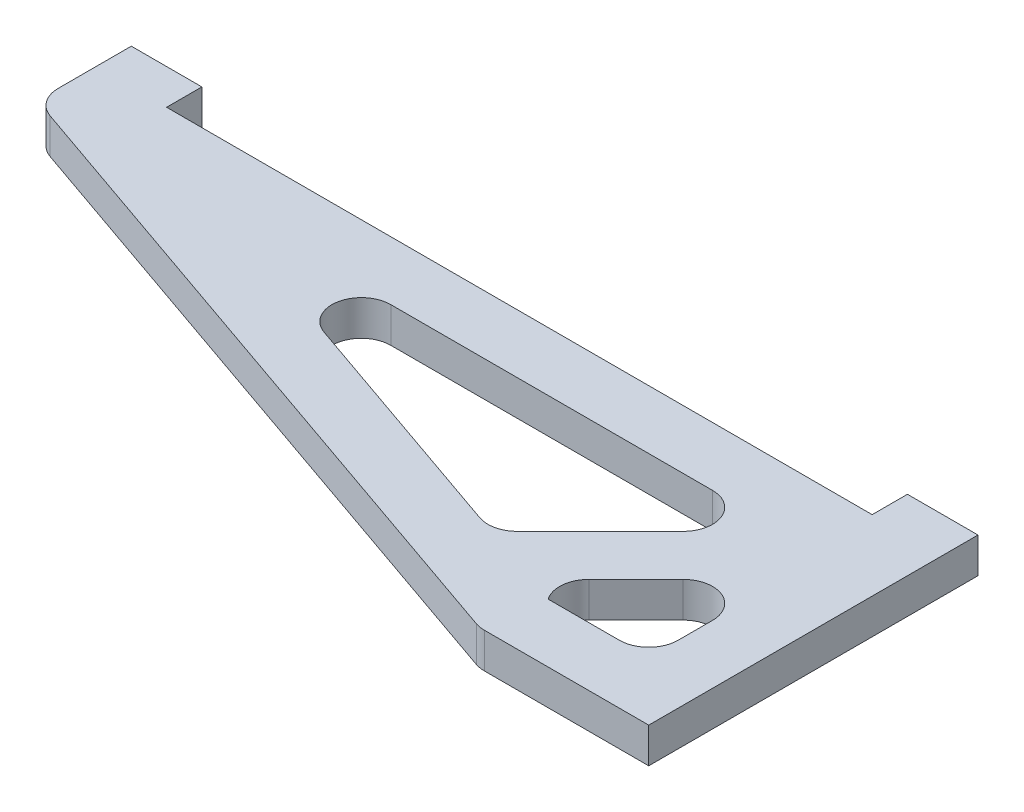
from build123d import *

# Parameters (mm, degrees)
SKETCH1_W           = 6
SKETCH1_H           = 3
BOSS_EXTRUDE1_DEPTH = 3
CUT_EXTRUDE1_REACH  = 41.31
FILLET1_R           = 2.5


with BuildPart() as part:
    # Sketch1 → Boss-Extrude1 (new body)
    with BuildSketch(Plane(origin=(0, 0, 0), x_dir=(1, 0, 0), z_dir=(0, 1, 0))):
        Polygon((-36, 12.5), (-36, 7.5), (21.6, -12.5), (36, -12.5), (36, 12.5), (30, 12.5), (-30, 12.5), align=None)
        with Locations((-33, 14)):
            Rectangle(SKETCH1_W, SKETCH1_H)
        with Locations((33, 14)):
            Rectangle(SKETCH1_W, SKETCH1_H)
    extrude(amount=BOSS_EXTRUDE1_DEPTH)

    # Sketch2 → Cut-Extrude1 (cut, up to next)
    with BuildSketch(Plane(origin=(0, 3, 0), x_dir=(1, 0, 0), z_dir=(0, 1, 0)), mode=Mode.PRIVATE) as cut_extrude1_sk1:
        Polygon((-20.75664079, 7.5), (15.036345763, -4.928120331), (27.464466094, 7.5), align=None)
    cut_extrude1_tool1 = extrude(cut_extrude1_sk1.sketch, amount=-CUT_EXTRUDE1_REACH, mode=Mode.PRIVATE) & part.part
    # Sketch2 → Cut-Extrude1 (cut, up to next)
    with BuildSketch(Plane(origin=(0, 3, 0), x_dir=(1, 0, 0), z_dir=(0, 1, 0)), mode=Mode.PRIVATE) as cut_extrude1_sk2:
        Polygon((31, 3.964466094), (20.284973417, -6.750560489), (22.44335921, -7.5), (31, -7.5), align=None)
    cut_extrude1_tool2 = extrude(cut_extrude1_sk2.sketch, amount=-CUT_EXTRUDE1_REACH, mode=Mode.PRIVATE) & part.part
    add(cut_extrude1_tool1.solids().sort_by_distance((7.248057, 3, -3.357293))[0], mode=Mode.SUBTRACT)
    add(cut_extrude1_tool2.solids().sort_by_distance((27.286818, 3, 3.618293))[0], mode=Mode.SUBTRACT)

    # Fillet1
    # the kernel refuses this fillet: 2.5 mm, written as the material it adds along each edge
    with BuildSketch(Plane(origin=(20.284973417, 3, 6.750560489), x_dir=(0.7071067811865467, 0, -0.7071067811865482), z_dir=(0, -1, 0))) as fillet1_piece_1:
        with BuildLine():
            CenterArc((3.456558168, 2.5), FILLET1_R, 190.226667661, 79.773332339)
            Line((0.99627547, 2.056142991), (0, 0))
            Line((0, 0), (3.456558168, 0))
        make_face()
    extrude(amount=3)
    with BuildSketch(Plane(origin=(31, 3, -3.964466094), x_dir=(0, 0, 1), z_dir=(0, -1, 0)), Plane(origin=(27.464466094, 3, -7.5), x_dir=(-0.7071067811865461, 0, 0.707106781186549), z_dir=(0, -1, 0))) as fillet1_piece_2:
        with BuildLine():
            CenterArc((FILLET1_R * 2.41421356237, FILLET1_R), FILLET1_R, 135, 135)
            Line((FILLET1_R * 1.70710678119, FILLET1_R * 1.70710678119), (0, 0))
            Line((0, 0), (FILLET1_R * 2.41421356237, 0))
        make_face()
    extrude(amount=3)
    with BuildSketch(Plane(origin=(31, 3, 7.5), x_dir=(0, 0, -1), z_dir=(0, -1, 0))) as fillet1_piece_3:
        with BuildLine():
            CenterArc((FILLET1_R, -FILLET1_R), FILLET1_R, 90, 90)
            Line((0, -FILLET1_R), (0, 0))
            Line((0, 0), (FILLET1_R, 0))
        make_face()
    extrude(amount=3)
    with BuildSketch(Plane(origin=(-20.75664079, 3, -7.5), x_dir=(0.9446736642347862, 0, 0.3280116889704124), z_dir=(0, -1, 0))) as fillet1_piece_4:
        with BuildLine():
            CenterArc((FILLET1_R * 5.92867184197, -FILLET1_R), FILLET1_R, 90, 160.851862542)
            Line((FILLET1_R * 5.600660153, -FILLET1_R * 1.94467366423), (0, 0))
            Line((0, 0), (FILLET1_R * 5.92867184197, 0))
        make_face()
    extrude(amount=3)
    with BuildSketch(Plane(origin=(15.036345763, 3, 4.928120331), x_dir=(-0.9446736642347863, 0, -0.3280116889704122), z_dir=(0, -1, 0))) as fillet1_piece_5:
        with BuildLine():
            CenterArc((FILLET1_R * 0.626668316014, FILLET1_R), FILLET1_R, 205.851862542, 64.148137458)
            Line((-FILLET1_R * 0.273256127554, FILLET1_R * 0.563954135591), (0, 0))
            Line((0, 0), (FILLET1_R * 0.626668316014, 0))
        make_face()
    extrude(amount=3)
    # the kernel refuses this fillet: 2.5 mm, written as the material it takes off along each edge
    with BuildSketch(Plane(origin=(21.6, -1.054199012, 12.5), x_dir=(-0.9446736642347879, 0, -0.32801168897040733), z_dir=(0, 1, 0))) as fillet1_2_piece_1:
        with BuildLine():
            CenterArc((FILLET1_R * 0.168671841967, -FILLET1_R), FILLET1_R, 90, 19.148137458)
            Line((-FILLET1_R * 0.159339847004, -FILLET1_R * 0.0553263357652), (0, 0))
            Line((0, 0), (FILLET1_R * 0.168671841967, 0))
        make_face()
    extrude(amount=5.108398025, mode=Mode.SUBTRACT)
    with BuildSketch(Plane(origin=(-36, -4.445902435, -7.5), x_dir=(0, 0, -1), z_dir=(0, 1, 0))) as fillet1_2_piece_2:
        with BuildLine():
            CenterArc((FILLET1_R * 0.711344389572, -FILLET1_R), FILLET1_R, 90, 70.851862542)
            Line((-FILLET1_R * 0.233329274663, -FILLET1_R * 0.67198831103), (0, 0))
            Line((0, 0), (FILLET1_R * 0.711344389572, 0))
        make_face()
    extrude(amount=11.89180487, mode=Mode.SUBTRACT)


solid = part.part
